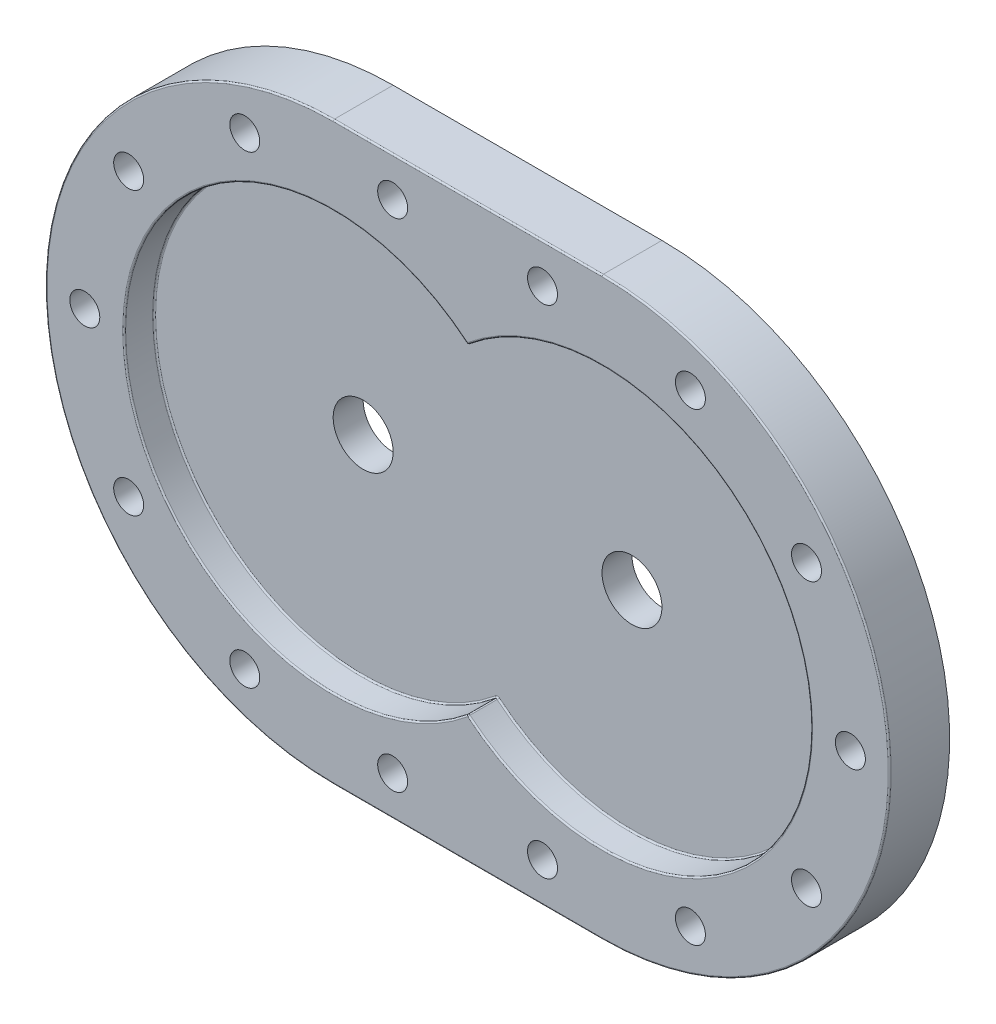
from build123d import *

# Parameters (mm, degrees)
BOSS_EXTRUDE1_DEPTH   = 20
SKETCH1_3_R           = 10
BOSS_EXTRUDE2_DEPTH   = 10
F_1_0MM_DOWEL_HOLE1_D = 10
CRVPATTERN1_OUTLINE_R = 5
CRVPATTERN1_DEPTH     = 20
FILLET1_R             = 0.5


# Read off the part's stored shape, not the designer's step: CrvPattern1
with BuildPart() as part:
    # Sketch1 → Boss-Extrude1 (new body)
    with BuildSketch(Plane.XY):
        with BuildLine():
            Line((-44.845, -96), (44.845, -96))
            ThreePointArc((44.845, -96), (140.845, 0), (44.845, 96))
            Line((44.845, 96), (-44.845, 96))
            ThreePointArc((-44.845, 96), (-140.845, 0), (-44.845, -96))
        make_face()
        with BuildLine():
            ThreePointArc((0, -53.422733691), (114.595, 0), (0, 53.422733691))
            ThreePointArc((0, 53.422733691), (-114.595, 0), (0, -53.422733691))
        make_face(mode=Mode.SUBTRACT)
    extrude(amount=BOSS_EXTRUDE1_DEPTH)

    # Sketch1<3> → Boss-Extrude2 (add)
    with BuildSketch(Plane.XY):
        with BuildLine():
            ThreePointArc((0, 53.422733691), (-114.595, 0), (0, -53.422733691))
            ThreePointArc((0, -53.422733691), (114.595, 0), (0, 53.422733691))
        make_face()
        with Locations((44.845, 0)):
            Circle(SKETCH1_3_R, mode=Mode.SUBTRACT)
        with Locations((-44.845, 0)):
            Circle(SKETCH1_3_R, mode=Mode.SUBTRACT)
    extrude(amount=BOSS_EXTRUDE2_DEPTH)

    # Ø1.0mm Dowel Hole1 (through all)
    with Locations(Plane.XY.offset(20)):
        with Locations((127.72, 0)):
            Hole(F_1_0MM_DOWEL_HOLE1_D / 2)

    # CrvPattern1 outline → CrvPattern1 (cut)
    with BuildSketch(Plane.XY):
        with Locations((113.085024418, 47.027276047)):
            Circle(CRVPATTERN1_OUTLINE_R)
        with Locations((74.348906367, 77.445368707)):
            Circle(CRVPATTERN1_OUTLINE_R)
        with Locations((25.003535083, 82.875)):
            Circle(CRVPATTERN1_OUTLINE_R)
        with Locations((-25.003535083, 82.875)):
            Circle(CRVPATTERN1_OUTLINE_R)
        with Locations((-74.348906367, 77.445368707)):
            Circle(CRVPATTERN1_OUTLINE_R)
        with Locations((-113.085024418, 47.027276047)):
            Circle(CRVPATTERN1_OUTLINE_R)
        with Locations((-127.72, 0)):
            Circle(CRVPATTERN1_OUTLINE_R)
        with Locations((-113.085024418, -47.027276047)):
            Circle(CRVPATTERN1_OUTLINE_R)
        with Locations((-74.348906367, -77.445368707)):
            Circle(CRVPATTERN1_OUTLINE_R)
        with Locations((-25.003535083, -82.875)):
            Circle(CRVPATTERN1_OUTLINE_R)
        with Locations((25.003535083, -82.875)):
            Circle(CRVPATTERN1_OUTLINE_R)
        with Locations((74.348906367, -77.445368707)):
            Circle(CRVPATTERN1_OUTLINE_R)
        with Locations((113.085024418, -47.027276047)):
            Circle(CRVPATTERN1_OUTLINE_R)
    extrude(amount=CRVPATTERN1_DEPTH, mode=Mode.SUBTRACT)

    # Fillet1
    fillet1_edges = [part.edges().sort_by_distance(p)[0] for p in [
        (-114.595, 0, 20),
        (0, 53.422733691, 15),
        (0, -53.422733691, 15),
        (0, -96, 20),
        (140.845, 0, 20),
        (-114.595, 0, 10),
        (114.595, 0, 10),
        (0, 96, 20),
        (-140.845, 0, 20),
        (114.595, 0, 20),
    ]]
    fillet(fillet1_edges, radius=FILLET1_R)


solid = part.part
